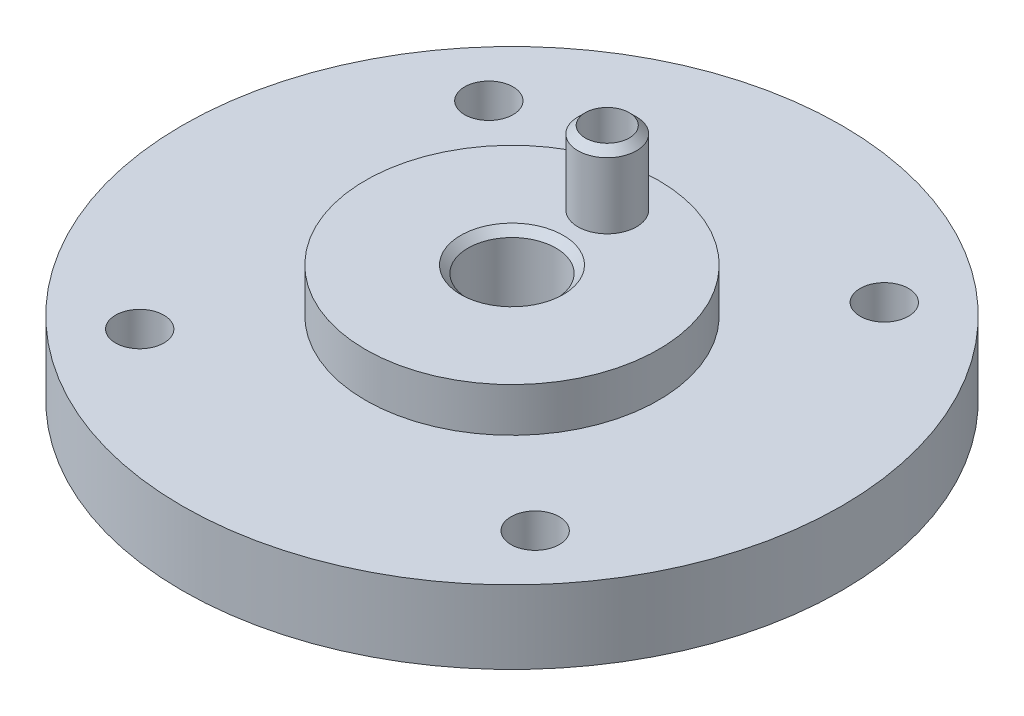
from build123d import *

# Parameters (mm, degrees)
SKETCH_1_R               = 22.5
EXTRUDE_1_DEPTH          = 5
SKETCH_2_R               = 10
EXTRUDE_2_DEPTH          = 5
EXTRUDE_START            = 3
SKETCH_4_R               = 10
EXTRUDE_3_DEPTH          = 3
CUT_EXTRUDE_2_DEPTH      = 35.372954485
CUT_EXTRUDE_2_DEPTH_BACK = 35.372954485
SKETCH_5_R               = 3
HOLE_WIZARD_M4_3_D       = 3.3
SKETCH_10_R              = 1.5
CUT_EXTRUDE_3_DEPTH      = 35.372954485
CHAMFER_2_SIZE           = 0.5
EXTRUDE_START_2          = 5
SKETCH_11_R              = 2
SKETCH_11_R_2            = 1.5
EXTRUDE_4_DEPTH          = 5
CHAMFER_3_SIZE           = 0.5


with BuildPart() as part:
    # 草图1 → 凸台-拉伸1 (new body)
    with BuildSketch(Plane(origin=(0, 0, 0), x_dir=(1, 0, 0), z_dir=(0, 1, 0))):
        with Locations(Location((0, 0, 0), (0, 0, 270))):
            Circle(SKETCH_1_R)
    extrude(amount=EXTRUDE_1_DEPTH)

    # 草图2 → 凸台-拉伸2 (add)
    with BuildSketch(Plane.XZ):
        with Locations(Location((0, 0, 0), (0, 0, 270))):
            Circle(SKETCH_2_R)
    extrude(amount=EXTRUDE_2_DEPTH)

    # 草图4 → 凸台-拉伸3 (add)
    with BuildSketch(Plane(origin=(0, 5, 0), x_dir=(1, 0, 0), z_dir=(0, 1, 0)).offset(EXTRUDE_START)):
        with Locations(Location((0, 0, 0), (0, 0, 90))):
            Circle(SKETCH_4_R)
    extrude(amount=-EXTRUDE_3_DEPTH)

    # 草图5 → 切除-拉伸2 (cut, two sides: drawn at the far end of the back side and taken through both)
    with BuildSketch(Plane(origin=(0, 8, 0), x_dir=(1, 0, 0), z_dir=(0, 1, 0)).offset(-CUT_EXTRUDE_2_DEPTH_BACK)):
        with Locations(Location((0, 0, 0), (0, 0, 270))):
            Circle(SKETCH_5_R)
    extrude(amount=CUT_EXTRUDE_2_DEPTH + CUT_EXTRUDE_2_DEPTH_BACK, mode=Mode.SUBTRACT)

    # M4 螺纹孔3 (through all)
    with Locations(Plane.XZ):
        with Locations((11.913336036, -13.493421527), (13.493421527, 11.913336036), (-11.913336036, 13.493421527), (-13.493421527, -11.913336036)):
            Hole(HOLE_WIZARD_M4_3_D / 2)

    # 草图10 → 切除-拉伸3 (cut, through all)
    with BuildSketch(Plane(origin=(0, 8, 0), x_dir=(1, 0, 0), z_dir=(0, 1, 0))):
        with Locations(Location((0, 6.5, 0), (0, 0, 270))):
            Circle(SKETCH_10_R)
    extrude(amount=-CUT_EXTRUDE_3_DEPTH, mode=Mode.SUBTRACT)

    # 倒角2
    chamfer_2_edges = [part.edges().sort_by_distance(p)[0] for p in [
        (0, 8, -3),
        (0, -5, -3),
    ]]
    chamfer(chamfer_2_edges, length=CHAMFER_2_SIZE)

    # 草图11 → 凸台-拉伸4 (add)
    with BuildSketch(Plane(origin=(0, 8, 0), x_dir=(1, 0, 0), z_dir=(0, 1, 0)).offset(EXTRUDE_START_2)):
        with Locations(Location((0, 6.5, 0), (0, 0, 270))):
            Circle(SKETCH_11_R)
        with Locations(Location((0, 6.5, 0), (0, 0, 270))):
            Circle(SKETCH_11_R_2, mode=Mode.SUBTRACT)
    extrude(amount=-EXTRUDE_4_DEPTH)

    # 倒角3
    chamfer_3_edges = [part.edges().sort_by_distance(p)[0] for p in [
        (0, 13, -8.5),
    ]]
    chamfer(chamfer_3_edges, length=CHAMFER_3_SIZE - 0.0001)  # a hair under: the kernel refuses the full size


solid = part.part
